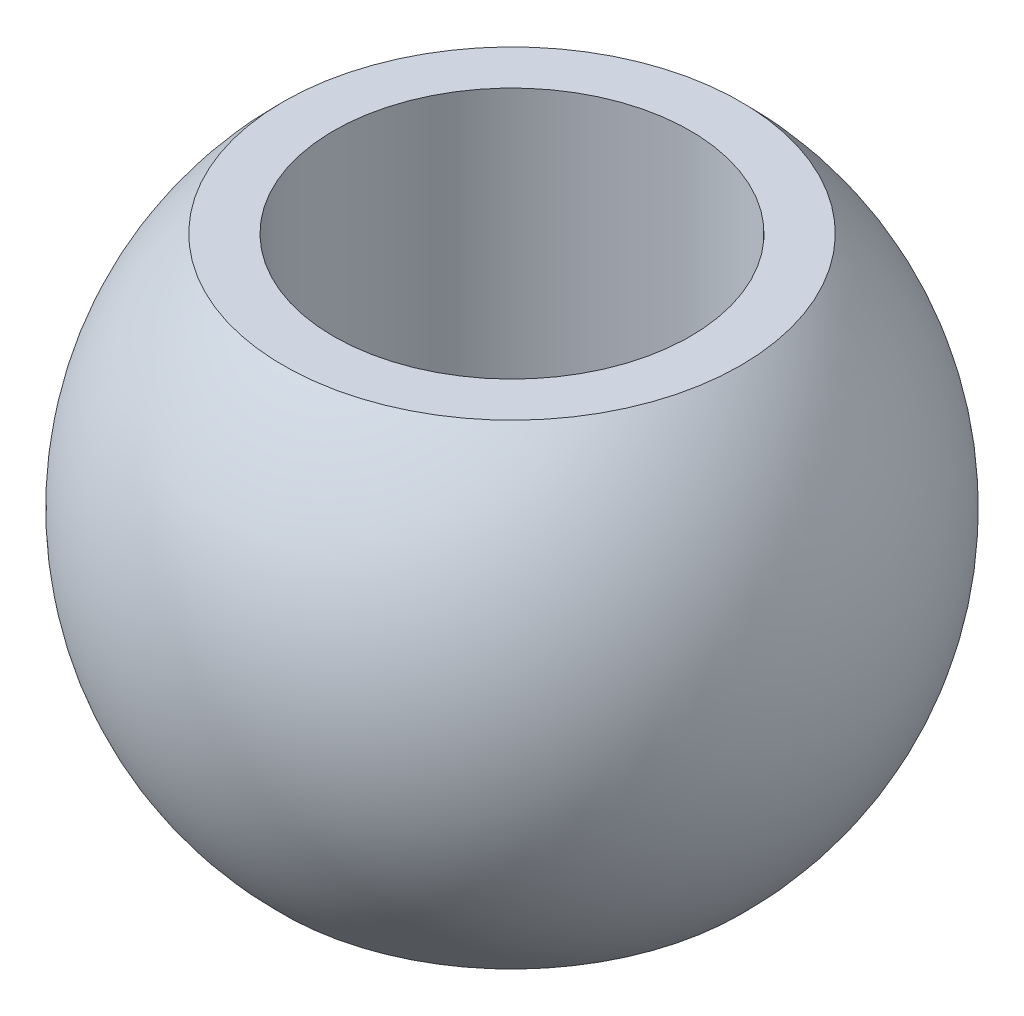
from build123d import *


with BuildPart() as part:
    # Szkic1 → Obrót1 (revolve)
    with BuildSketch(Plane.XY):
        with BuildLine():
            Line((-7.694803441, 8), (-6, 8))
            Line((-6, 8), (-6, -8))
            Line((-6, -8), (-7.694803441, -8))
            ThreePointArc((-7.694803441, -8), (-11.1, 0), (-7.694803441, 8))
        make_face()
    revolve(axis=Axis((0, 8, 0), (0, -1, 0)))


solid = part.part
